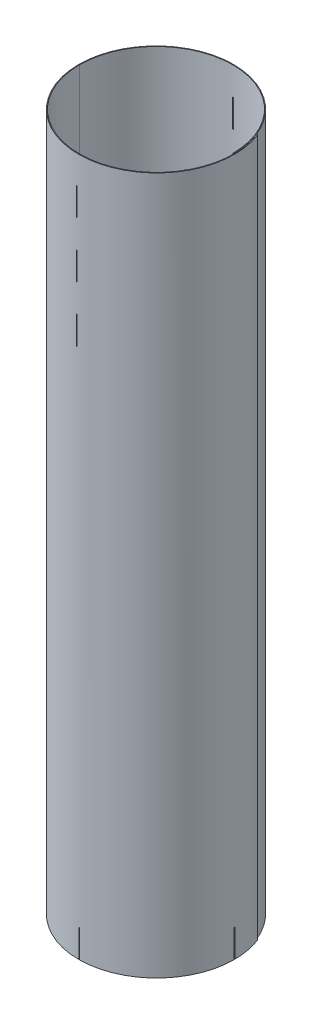
from build123d import *

# Parameters (mm, degrees)
BASE_FLANGE1_DEPTH   = 250
UNFOLD1_START        = -250
UNFOLD1_DEPTH        = 250
UNFOLD1_2_DEPTH      = 250
SKETCH6_W            = 0.3
SKETCH6_H            = 10
CUT_EXTRUDE1_DEPTH   = 311.743338181
LPATTERN1_COUNT      = 2
LPATTERN1_PITCH      = 86.4
LPATTERN1_COUNT_DIR2 = 3
LPATTERN1_PITCH_DIR2 = 20
SKETCH7_W            = 0.3
SKETCH7_H            = 10
CUT_EXTRUDE2_DEPTH   = 311.743338181
LPATTERN2_COUNT      = 5
LPATTERN2_PITCH      = 43.4969
FOLD1_START          = -250
FOLD1_DEPTH          = 250
FOLD1_2_DEPTH        = 10
FOLD1_3_DEPTH        = 250
FOLD1_START_2        = -240
FOLD1_4_DEPTH        = 180
FOLD1_START_3        = -60
FOLD1_5_DEPTH        = 60
FOLD1_START_4        = -50
FOLD1_6_DEPTH        = 10
FOLD1_START_5        = -30
FOLD1_7_DEPTH        = 10
FOLD1_START_6        = -10
FOLD1_8_DEPTH        = 10
FOLD1_9_DEPTH        = 10


# Read off the part's stored shape, not the designer's step: Unfold1, Fold1
# Sheet-metal steps are written as plain solids
with BuildPart() as part:
    # Sketch1 → Base-Flange1 (new body)
    with BuildSketch(Plane(origin=(0, 0, 0), x_dir=(1, 0, 0), z_dir=(0, 1, 0))):
        with BuildLine():
            ThreePointArc((27.5, 0), (0, 27.5), (-27.5, 0))
            ThreePointArc((-27.5, 0), (5.334991298, -27.197244319), (25.943416257, 10.127272727))
            Line((25.943416257, 10.127272727), (26.176084396, 10.21873604))
            ThreePointArc((26.176084396, 10.21873604), (5.381536789, -27.442873139), (-27.75, 0))
            ThreePointArc((-27.75, 0), (0, 27.75), (27.75, 0))
            Line((27.75, 0), (27.5, 0))
        make_face()
    extrude(amount=-BASE_FLANGE1_DEPTH)

    # Unfold1 outline → Unfold1 (cut)
    with BuildSketch(Plane(origin=(0, 0, 0), x_dir=(1, 0, 0), z_dir=(0, 1, 0)).offset(UNFOLD1_START)):
        with BuildLine():
            Line((27.5, 4.465057679), (27.5, 5.81720394))
            ThreePointArc((27.5, 5.81720394), (26.928734746, 8.045248964), (26.176084396, 10.21873604))
            Line((26.176084396, 10.21873604), (25.943416257, 10.127272727))
            ThreePointArc((25.943416257, 10.127272727), (26.872280055, 7.337558511), (27.5, 4.465057679))
        make_face()
        with BuildLine():
            ThreePointArc((-27.75, 0), (2.431208617, -27.840474058), (27.75, 4.485307483))
            Line((27.75, 4.485307483), (27.75, 2.492962419))
            ThreePointArc((27.75, 2.492962419), (1.428992542, -27.653107247), (-27.5, 0))
            ThreePointArc((-27.5, 0), (0, 27.5), (27.5, 0))
            Line((27.5, 0), (27.5, 3.716517187))
            ThreePointArc((27.5, 3.716517187), (-1.862458053, 27.687429458), (-27.75, 0))
        make_face()
    extrude(amount=UNFOLD1_DEPTH, mode=Mode.SUBTRACT)

    # Unfold1 2 outline → Unfold1 2 (add)
    with BuildSketch(Plane(origin=(0, 0, 0), x_dir=(1, 0, 0), z_dir=(0, 1, 0)).offset(UNFOLD1_START)):
        with BuildLine():
            Line((27.5, 184.557199058), (27.5, 5.81720394))
            ThreePointArc((27.5, 5.81720394), (27.633078737, 5.152772109), (27.75, 4.485307483))
            Line((27.75, 4.485307483), (27.75, 184.557199058))
            Line((27.75, 184.557199058), (27.5, 184.557199058))
        make_face()
        with BuildLine():
            ThreePointArc((27.75, 2.492962419), (27.642708515, 3.481254935), (27.5, 4.465057679))
            Line((27.5, 4.465057679), (27.5, 3.716517187))
            ThreePointArc((27.5, 3.716517187), (27.687429458, 1.862458053), (27.75, 0))
            Line((27.75, 0), (27.75, 2.492962419))
        make_face()
    extrude(amount=UNFOLD1_2_DEPTH)

    # Sketch6 → Cut-Extrude1 (cut, through all)
    with BuildSketch(Plane(origin=(27.75, 0, 0), x_dir=(0, 0, -1), z_dir=(1, 0, 0))):
        with Locations((43.35, -15)):
            Rectangle(SKETCH6_W, SKETCH6_H)
    cut_extrude1 = extrude(amount=-CUT_EXTRUDE1_DEPTH, mode=Mode.SUBTRACT)

    # LPattern1: Cut-Extrude1 2 × 3
    with Locations(*[(0, -j * LPATTERN1_PITCH_DIR2, -i * LPATTERN1_PITCH) for i in range(LPATTERN1_COUNT) for j in range(LPATTERN1_COUNT_DIR2) if (i, j) != (0, 0)]):
        add(cut_extrude1, mode=Mode.SUBTRACT)

    # Sketch7 → Cut-Extrude2 (cut, through all)
    with BuildSketch(Plane(origin=(27.75, 0, 0), x_dir=(0, 0, -1), z_dir=(1, 0, 0))):
        with Locations((0.15, -245)):
            Rectangle(SKETCH7_W, SKETCH7_H)
    cut_extrude2 = extrude(amount=-CUT_EXTRUDE2_DEPTH, mode=Mode.SUBTRACT)

    # LPattern2: Cut-Extrude2 ×5
    with Locations(*[(0, 0, -i * LPATTERN2_PITCH) for i in range(1, LPATTERN2_COUNT)]):
        add(cut_extrude2, mode=Mode.SUBTRACT)

    # Fold1 outline → Fold1 (cut)
    with BuildSketch(Plane(origin=(0, 0, 0), x_dir=(1, 0, 0), z_dir=(0, 1, 0)).offset(FOLD1_START)):
        with BuildLine():
            Line((27.5, 4.465057679), (27.5, 3.716517187))
            ThreePointArc((27.5, 3.716517187), (27.687429458, 1.862458053), (27.75, 0))
            Line((27.75, 0), (27.75, 2.492962419))
            ThreePointArc((27.75, 2.492962419), (27.642708515, 3.481254935), (27.5, 4.465057679))
        make_face()
        with BuildLine():
            ThreePointArc((27.5, 5.81720394), (27.633078737, 5.152772109), (27.75, 4.485307483))
            Line((27.75, 4.485307483), (27.75, 184.557199058))
            Line((27.75, 184.557199058), (27.5, 184.557199058))
            Line((27.5, 184.557199058), (27.5, 5.81720394))
        make_face()
    extrude(amount=FOLD1_DEPTH, mode=Mode.SUBTRACT)

    # Fold1 2 outline → Fold1 2 (cut)
    with BuildSketch(Plane(origin=(0, 0, 0), x_dir=(1, 0, 0), z_dir=(0, 1, 0)).offset(FOLD1_START)):
        with BuildLine():
            ThreePointArc((27.748378331, 0.3), (27.748371017, 0.300675772), (27.748363686, 0.301351543))
            Line((27.748363686, 0.301351543), (27.623914005, 0.3))
            Line((27.623914005, 0.3), (27.748378331, 0.3))
        make_face()
    extrude(amount=FOLD1_2_DEPTH, mode=Mode.SUBTRACT)

    # Fold1 3 outline → Fold1 3 (add)
    with BuildSketch(Plane(origin=(0, 0, 0), x_dir=(1, 0, 0), z_dir=(0, 1, 0)).offset(FOLD1_START)):
        with BuildLine():
            Line((0.194121372, 27.749321017), (0.192372531, 27.499327134))
            ThreePointArc((0.192372531, 27.499327134), (19.407828644, 19.482971727), (27.498378428, 0.298636664))
            Line((27.498378428, 0.298636664), (27.623914005, 0.3))
            Line((27.623914005, 0.3), (27.5, 0.3))
            Line((27.5, 0.3), (27.5, 3.716517187))
            ThreePointArc((27.5, 3.716517187), (18.333984963, 20.830926417), (0.194121372, 27.749321017))
        make_face()
        with BuildLine():
            ThreePointArc((25.943416257, 10.127272727), (26.872280055, 7.337558511), (27.5, 4.465057679))
            Line((27.5, 4.465057679), (27.5, 5.81720394))
            ThreePointArc((27.5, 5.81720394), (26.928734746, 8.045248964), (26.176084396, 10.21873604))
            Line((26.176084396, 10.21873604), (25.943416257, 10.127272727))
        make_face()
        with BuildLine():
            ThreePointArc((-27.5, 0), (-19.586982848, 19.302852196), (-0.401810697, 27.497064355))
            Line((-0.401810697, 27.497064355), (-0.405463521, 27.747037668))
            ThreePointArc((-0.405463521, 27.747037668), (-19.765046328, 19.478332671), (-27.75, 0))
            ThreePointArc((-27.75, 0), (-27.749805944, -0.104117185), (-27.74922378, -0.208232924))
            Line((-27.74922378, -0.208232924), (-27.499230728, -0.206369125))
            ThreePointArc((-27.499230728, -0.206369125), (-27.499807681, -0.103185279), (-27.5, 0))
        make_face()
        with BuildLine():
            Line((27.75, 4.485307483), (27.75, 2.492962419))
            ThreePointArc((27.75, 2.492962419), (27.830997978, 1.319952212), (27.86210871, 0.144560473))
            Line((27.86210871, 0.144560473), (28.112105301, 0.145866054))
            ThreePointArc((28.112105301, 0.145866054), (28.015747193, 2.322654117), (27.75, 4.485307483))
        make_face()
        with BuildLine():
            Line((28.112053433, -0.155481098), (27.862057305, -0.154089457))
            ThreePointArc((27.862057305, -0.154089457), (19.815096757, -19.513149653), (0.506027414, -27.679337678))
            Line((0.506027414, -27.679337678), (0.508960666, -27.929320469))
            ThreePointArc((0.508960666, -27.929320469), (19.992417674, -19.689380446), (28.112053433, -0.155481098))
        make_face()
        with BuildLine():
            ThreePointArc((-0.67917386, -27.667867677), (-19.517647079, -19.447492002), (-27.49539326, -0.504994403))
            Line((-27.49539326, -0.504994403), (-27.745351655, -0.509555202))
            ThreePointArc((-27.745351655, -0.509555202), (-19.695555366, -19.623129815), (-0.686944618, -27.917746878))
            Line((-0.686944618, -27.917746878), (-0.67917386, -27.667867677))
        make_face()
        with BuildLine():
            Line((0.207619564, -27.931230638), (0.20738348, -27.681230749))
            ThreePointArc((0.20738348, -27.681230749), (-0.08663462, -27.679946905), (-0.380622499, -27.675540215))
            Line((-0.380622499, -27.675540215), (-0.385696924, -27.92548871))
            ThreePointArc((-0.385696924, -27.92548871), (-0.089053927, -27.929935198), (0.207619564, -27.931230638))
        make_face()
    extrude(amount=FOLD1_3_DEPTH)

    # Fold1 4 outline → Fold1 4 (add)
    with BuildSketch(Plane(origin=(0, 0, 0), x_dir=(1, 0, 0), z_dir=(0, 1, 0)).offset(FOLD1_START_2)):
        with BuildLine():
            Line((0.192372531, 27.499327134), (0.194121372, 27.749321017))
            ThreePointArc((0.194121372, 27.749321017), (-0.105677242, 27.74979878), (-0.405463521, 27.747037668))
            Line((-0.405463521, 27.747037668), (-0.401810697, 27.497064355))
            ThreePointArc((-0.401810697, 27.497064355), (-0.104725195, 27.499800593), (0.192372531, 27.499327134))
        make_face()
        with BuildLine():
            Line((27.5, 0.298654275), (27.498378428, 0.298636664))
            ThreePointArc((27.498378428, 0.298636664), (27.499594604, 0.149320533), (27.5, 0))
            Line((27.5, 0), (27.5, 0.298654275))
        make_face()
        with BuildLine():
            Line((28.112105301, 0.145866054), (27.86210871, 0.144560473))
            ThreePointArc((27.86210871, 0.144560473), (27.862485773, -0.004764561), (27.862057305, -0.154089457))
            Line((27.862057305, -0.154089457), (28.112053433, -0.155481098))
            ThreePointArc((28.112053433, -0.155481098), (28.11248577, -0.004807592), (28.112105301, 0.145866054))
        make_face()
        with BuildLine():
            ThreePointArc((-27.49539326, -0.504994403), (-27.497714727, -0.355686939), (-27.499230728, -0.206369125))
            Line((-27.499230728, -0.206369125), (-27.74922378, -0.208232924))
            ThreePointArc((-27.74922378, -0.208232924), (-27.747694087, -0.358899285), (-27.745351655, -0.509555202))
            Line((-27.745351655, -0.509555202), (-27.49539326, -0.504994403))
        make_face()
        with BuildLine():
            Line((0.508960666, -27.929320469), (0.506027414, -27.679337678))
            ThreePointArc((0.506027414, -27.679337678), (0.356708, -27.680686971), (0.20738348, -27.681230749))
            Line((0.20738348, -27.681230749), (0.207619564, -27.931230638))
            ThreePointArc((0.207619564, -27.931230638), (0.358292691, -27.930681948), (0.508960666, -27.929320469))
        make_face()
        with BuildLine():
            ThreePointArc((-0.380622499, -27.675540215), (-0.529908527, -27.672106579), (-0.67917386, -27.667867677))
            Line((-0.67917386, -27.667867677), (-0.686944618, -27.917746878))
            ThreePointArc((-0.686944618, -27.917746878), (-0.536331212, -27.922024063), (-0.385696924, -27.92548871))
            Line((-0.385696924, -27.92548871), (-0.380622499, -27.675540215))
        make_face()
    extrude(amount=FOLD1_4_DEPTH)

    # Fold1 5 outline → Fold1 5 (add)
    with BuildSketch(Plane(origin=(0, 0, 0), x_dir=(1, 0, 0), z_dir=(0, 1, 0)).offset(FOLD1_START_3)):
        with BuildLine():
            Line((27.5, 0.298654275), (27.498378428, 0.298636664))
            ThreePointArc((27.498378428, 0.298636664), (27.499594604, 0.149320533), (27.5, 0))
            Line((27.5, 0), (27.5, 0.298654275))
        make_face()
        with BuildLine():
            ThreePointArc((-0.401810697, 27.497064355), (-0.254043101, 27.498826559), (-0.106268169, 27.499794673))
            Line((-0.106268169, 27.499794673), (-0.107234244, 27.749792807))
            ThreePointArc((-0.107234244, 27.749792807), (-0.256352584, 27.748815891), (-0.405463521, 27.747037668))
            Line((-0.405463521, 27.747037668), (-0.401810697, 27.497064355))
        make_face()
        with BuildLine():
            Line((28.112105301, 0.145866054), (27.86210871, 0.144560473))
            ThreePointArc((27.86210871, 0.144560473), (27.862485773, -0.004764561), (27.862057305, -0.154089457))
            Line((27.862057305, -0.154089457), (28.112053433, -0.155481098))
            ThreePointArc((28.112053433, -0.155481098), (28.11248577, -0.004807592), (28.112105301, 0.145866054))
        make_face()
        with BuildLine():
            ThreePointArc((-27.49539326, -0.504994403), (-27.497714727, -0.355686939), (-27.499230728, -0.206369125))
            Line((-27.499230728, -0.206369125), (-27.74922378, -0.208232924))
            ThreePointArc((-27.74922378, -0.208232924), (-27.747694087, -0.358899285), (-27.745351655, -0.509555202))
            Line((-27.745351655, -0.509555202), (-27.49539326, -0.504994403))
        make_face()
        with BuildLine():
            Line((0.508960666, -27.929320469), (0.506027414, -27.679337678))
            ThreePointArc((0.506027414, -27.679337678), (0.356708, -27.680686971), (0.20738348, -27.681230749))
            Line((0.20738348, -27.681230749), (0.207619564, -27.931230638))
            ThreePointArc((0.207619564, -27.931230638), (0.358292691, -27.930681948), (0.508960666, -27.929320469))
        make_face()
    extrude(amount=FOLD1_5_DEPTH)

    # Fold1 6 outline → Fold1 6 (add)
    with BuildSketch(Plane(origin=(0, 0, 0), x_dir=(1, 0, 0), z_dir=(0, 1, 0)).offset(FOLD1_START_4)):
        with BuildLine():
            Line((0.192372531, 27.499327134), (0.194121372, 27.749321017))
            ThreePointArc((0.194121372, 27.749321017), (0.043444204, 27.749965993), (-0.107234244, 27.749792807))
            Line((-0.107234244, 27.749792807), (-0.106268169, 27.499794673))
            ThreePointArc((-0.106268169, 27.499794673), (0.043052816, 27.499966299), (0.192372531, 27.499327134))
        make_face()
        with BuildLine():
            ThreePointArc((-0.380622499, -27.675540215), (-0.529908527, -27.672106579), (-0.67917386, -27.667867677))
            Line((-0.67917386, -27.667867677), (-0.686944618, -27.917746878))
            ThreePointArc((-0.686944618, -27.917746878), (-0.536331212, -27.922024063), (-0.385696924, -27.92548871))
            Line((-0.385696924, -27.92548871), (-0.380622499, -27.675540215))
        make_face()
    extrude(amount=FOLD1_6_DEPTH)

    # Fold1 7 outline → Fold1 7 (add)
    with BuildSketch(Plane(origin=(0, 0, 0), x_dir=(1, 0, 0), z_dir=(0, 1, 0)).offset(FOLD1_START_5)):
        with BuildLine():
            Line((0.192372531, 27.499327134), (0.194121372, 27.749321017))
            ThreePointArc((0.194121372, 27.749321017), (0.043444204, 27.749965993), (-0.107234244, 27.749792807))
            Line((-0.107234244, 27.749792807), (-0.106268169, 27.499794673))
            ThreePointArc((-0.106268169, 27.499794673), (0.043052816, 27.499966299), (0.192372531, 27.499327134))
        make_face()
        with BuildLine():
            ThreePointArc((-0.380622499, -27.675540215), (-0.529908527, -27.672106579), (-0.67917386, -27.667867677))
            Line((-0.67917386, -27.667867677), (-0.686944618, -27.917746878))
            ThreePointArc((-0.686944618, -27.917746878), (-0.536331212, -27.922024063), (-0.385696924, -27.92548871))
            Line((-0.385696924, -27.92548871), (-0.380622499, -27.675540215))
        make_face()
    extrude(amount=FOLD1_7_DEPTH)

    # Fold1 8 outline → Fold1 8 (add)
    with BuildSketch(Plane(origin=(0, 0, 0), x_dir=(1, 0, 0), z_dir=(0, 1, 0)).offset(FOLD1_START_6)):
        with BuildLine():
            Line((0.192372531, 27.499327134), (0.194121372, 27.749321017))
            ThreePointArc((0.194121372, 27.749321017), (0.043444204, 27.749965993), (-0.107234244, 27.749792807))
            Line((-0.107234244, 27.749792807), (-0.106268169, 27.499794673))
            ThreePointArc((-0.106268169, 27.499794673), (0.043052816, 27.499966299), (0.192372531, 27.499327134))
        make_face()
        with BuildLine():
            ThreePointArc((-0.380622499, -27.675540215), (-0.529908527, -27.672106579), (-0.67917386, -27.667867677))
            Line((-0.67917386, -27.667867677), (-0.686944618, -27.917746878))
            ThreePointArc((-0.686944618, -27.917746878), (-0.536331212, -27.922024063), (-0.385696924, -27.92548871))
            Line((-0.385696924, -27.92548871), (-0.380622499, -27.675540215))
        make_face()
    extrude(amount=FOLD1_8_DEPTH)

    # Fold1 9 outline → Fold1 9 (add)
    with BuildSketch(Plane(origin=(0, 0, 0), x_dir=(1, 0, 0), z_dir=(0, 1, 0)).offset(FOLD1_START)):
        with BuildLine():
            ThreePointArc((-0.103182219, 27.499806425), (0.0445958, 27.49996384), (0.192372531, 27.499327134))
            Line((0.192372531, 27.499327134), (0.194121372, 27.749321017))
            ThreePointArc((0.194121372, 27.749321017), (0.045001216, 27.749963512), (-0.104120239, 27.749804666))
            Line((-0.104120239, 27.749804666), (-0.103182219, 27.499806425))
        make_face()
        with BuildLine():
            ThreePointArc((-0.380622499, -27.675540215), (-0.529908527, -27.672106579), (-0.67917386, -27.667867677))
            Line((-0.67917386, -27.667867677), (-0.686944618, -27.917746878))
            ThreePointArc((-0.686944618, -27.917746878), (-0.536331212, -27.922024063), (-0.385696924, -27.92548871))
            Line((-0.385696924, -27.92548871), (-0.380622499, -27.675540215))
        make_face()
    extrude(amount=FOLD1_9_DEPTH)


solid = part.part
